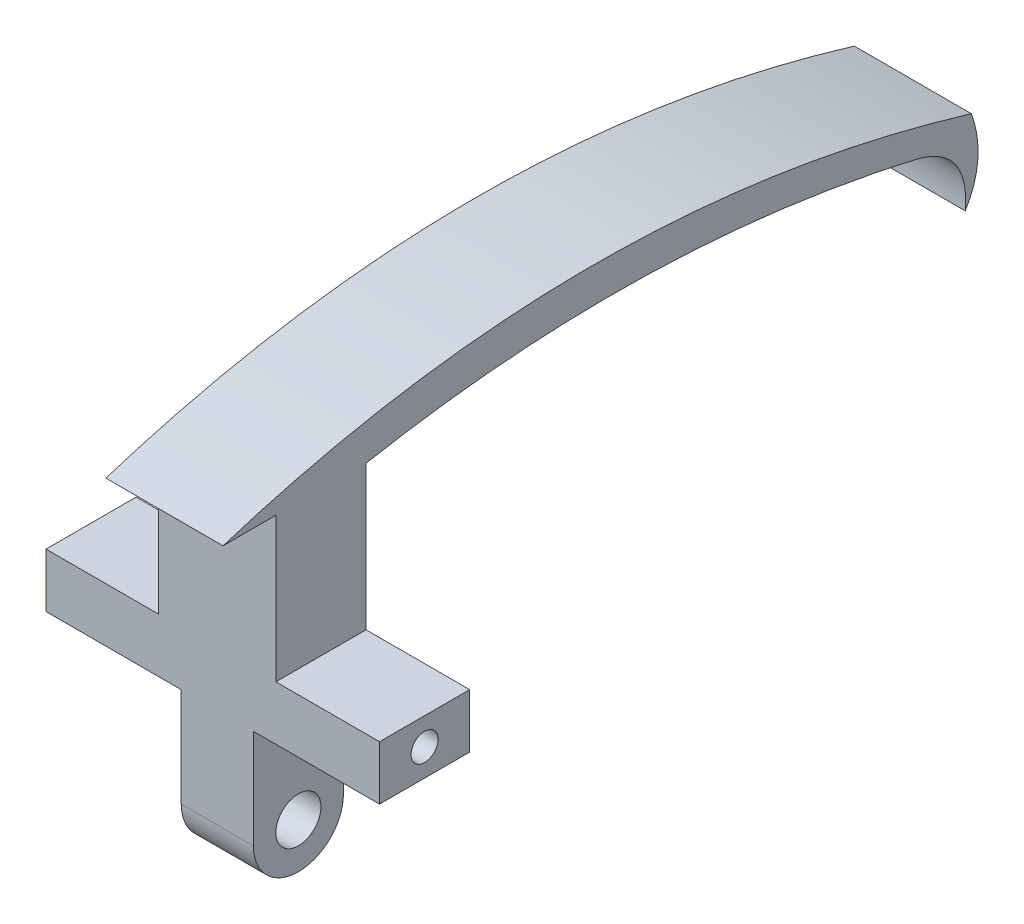
from build123d import *

# Parameters (mm, degrees)
SKETCH_1_W          = 180
SKETCH_1_H          = 50
EXTRUDE_1_DEPTH     = 30
SKETCH_2_W          = 40
SKETCH_2_H          = 50
EXTRUDE_2_DEPTH     = 80
FILLET_1_R          = 25
SKETCH_3_R          = 12.5
CUT_EXTRUDE_2_DEPTH = 145.913767462
SKETCH_7_W          = 25
SKETCH_7_H          = 50
EXTRUDE_5_DEPTH     = 80
EXTRUDE_6_REACH     = 213.019
SKETCH_9_W          = 25.5
SKETCH_9_H          = 50
CUT_EXTRUDE_3_DEPTH = 401.320460854
SKETCH_10_W         = 65
SKETCH_10_H         = 50
EXTRUDE_7_DEPTH     = 80
SKETCH_11_W         = 50
SKETCH_11_H         = 30
EXTRUDE_8_DEPTH     = 10
SKETCH_12_W         = 50
SKETCH_12_H         = 30
CUT_EXTRUDE_4_DEPTH = 5
SKETCH_13_R         = 7.5
CUT_EXTRUDE_5_DEPTH = 412.96204223


with BuildPart() as part:
    # 草图1 → 凸台-拉伸1 (new body)
    with BuildSketch(Plane(origin=(0, 0, 0), x_dir=(1, 0, 0), z_dir=(0, 1, 0))):
        with Locations((90, -25)):
            Rectangle(SKETCH_1_W, SKETCH_1_H)
    extrude(amount=EXTRUDE_1_DEPTH)

    # 草图2 → 凸台-拉伸2 (add)
    with BuildSketch(Plane.XZ):
        with Locations((90, 25)):
            Rectangle(SKETCH_2_W, SKETCH_2_H)
    extrude(amount=EXTRUDE_2_DEPTH)

    # 圆角1
    fillet_1_edges = [part.edges().sort_by_distance(p)[0] for p in [
        (90, -80, 50),
        (90, -80, 0),
    ]]
    fillet(fillet_1_edges, radius=FILLET_1_R - 0.0001)  # a hair under: the kernel refuses the full size

    # 草图3 → 切除-拉伸2 (cut, through all)
    with BuildSketch(Plane(origin=(110, 0, 0), x_dir=(0, 0, -1), z_dir=(1, 0, 0))):
        with Locations((-25, -55)):
            Circle(SKETCH_3_R)
    extrude(amount=-CUT_EXTRUDE_2_DEPTH, mode=Mode.SUBTRACT)

    # 草图7 → 凸台-拉伸5 (add)
    with BuildSketch(Plane(origin=(0, 30, 0), x_dir=(1, 0, 0), z_dir=(0, 1, 0))):
        with Locations((19.5, -25)):
            Rectangle(SKETCH_7_W, SKETCH_7_H)
        with Locations((160.5, -25)):
            Rectangle(SKETCH_7_W, SKETCH_7_H)
    extrude(amount=EXTRUDE_5_DEPTH)

    # 凸台-拉伸6: up to this face of the body (flat: up to its plane)
    extrude_6_end = Plane(part.part.faces().sort_by_distance((7, 70, 25))[0])
    # 草图8 → 凸台-拉伸6 (add, up to the picked face)
    with BuildSketch(Plane(origin=(173, 0, 0), x_dir=(0, 0, -1), z_dir=(1, 0, 0)), mode=Mode.PRIVATE) as extrude_6_sk1:
        with BuildLine():
            Line((0, 110), (-79.29372145, 110))
            add(Edge.make_bspline(
                [(-79.29372145, 110), (123.322725029, 174.375095478), (335.808448859, 110)],
                knots=[0, 0, 0, 1, 1, 1], degree=2))
            add(Edge.make_bspline(
                [(335.808448859, 110), (344.655163531, 85.008885119), (332.386652106, 65.024574676)],
                knots=[0, 0, 0, 1, 1, 1], degree=2))
            add(Edge.make_bspline(
                [(332.386652106, 65.024574676), (334.882025134, 94.793074398), (307.328252939, 102.88474179)],
                knots=[0, 0, 0, 1, 1, 1], degree=2))
            add(Edge.make_bspline(
                [(307.328252939, 102.88474179), (153.571097441, 138.708355764), (0, 110)],
                knots=[0, 0, 0, 1, 1, 1], degree=2))
        make_face()
    extrude_6_tool1 = split(extrude(extrude_6_sk1.sketch, amount=-EXTRUDE_6_REACH, mode=Mode.PRIVATE), bisect_by=extrude_6_end, keep=Keep.BOTH, mode=Mode.PRIVATE)
    add(extrude_6_tool1.solids().sort_by(Axis((173, 122.914419, -143.709252), (-1, 0, 0)))[0])

    # 草图9 → 切除-拉伸3 (cut, through all)
    with BuildSketch(Plane(origin=(0, 30, 0), x_dir=(1, 0, 0), z_dir=(0, 1, 0))):
        Polygon((57.5, -50), (32, -50), (32, 0), (57.5, 0), (57.5, 350.332715619), (7, 350.332715619), (7, -79.29372145), (57.5, -79.29372145), align=None)
        Polygon((148, -50), (122.5, -50), (122.5, -79.29372145), (173, -79.29372145), (173, 350.332715619), (122.5, 350.332715619), (122.5, 0), (148, 0), align=None)
        with Locations((44.75, -25)):
            Rectangle(SKETCH_9_W, SKETCH_9_H)
        with Locations((135.25, -25)):
            Rectangle(SKETCH_9_W, SKETCH_9_H)
    extrude(amount=CUT_EXTRUDE_3_DEPTH, mode=Mode.SUBTRACT)


with BuildPart() as cut_extrude_3_piece_1:
    # of the separate pieces the step leaves, piece 1, a body of its own (cut_extrude_3_pieces)
    add(part.part.solids().sort_by_distance((122.5, 110, 0))[0])



with BuildPart() as cut_extrude_3_piece_2:
    # of the separate pieces the step leaves, piece 2, a body of its own (cut_extrude_3_pieces)
    add(part.part.solids().sort_by_distance((110, -55.0001, 0))[0])


with BuildPart() as cut_extrude_3_piece_1_1:
    add(cut_extrude_3_piece_1.part)

    add(cut_extrude_3_piece_2.part)  # 凸台-拉伸7 merges 切除-拉伸3 piece 2
    # 草图10 → 凸台-拉伸7 (add)
    with BuildSketch(Plane.XZ.offset(-110)):
        with Locations((90, 25)):
            Rectangle(SKETCH_10_W, SKETCH_10_H)
    extrude(amount=EXTRUDE_7_DEPTH)

    # 草图11 → 凸台-拉伸8 (add)
    with BuildSketch(Plane.ZY):
        with Locations((25, 15)):
            Rectangle(SKETCH_11_W, SKETCH_11_H)
    extrude(amount=EXTRUDE_8_DEPTH)

    # 草图12 → 切除-拉伸4 (cut)
    with BuildSketch(Plane.ZY.offset(10)):
        with Locations((25, 15)):
            Rectangle(SKETCH_12_W, SKETCH_12_H)
    extrude(amount=-CUT_EXTRUDE_4_DEPTH, mode=Mode.SUBTRACT)

    # 草图13 → 切除-拉伸5 (cut, through all)
    with BuildSketch(Plane.ZY.offset(5)):
        with Locations((25, 15)):
            Circle(SKETCH_13_R)
    extrude(amount=-CUT_EXTRUDE_5_DEPTH, mode=Mode.SUBTRACT)


solid = cut_extrude_3_piece_1_1.part
